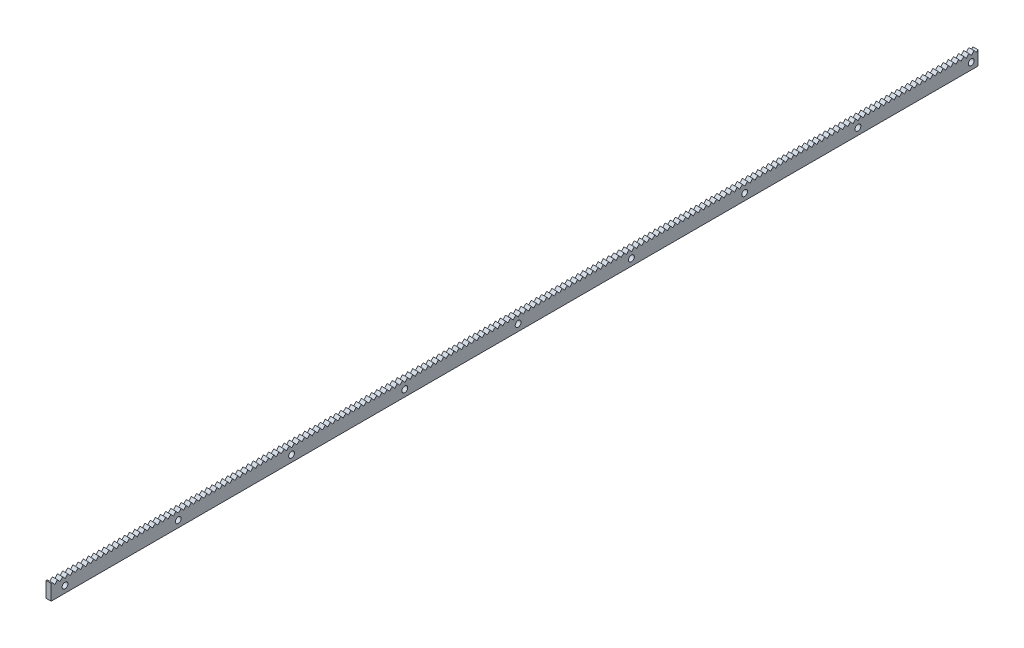
from build123d import *

# Parameters (mm, degrees)
SKETCH1_W           = 5
SKETCH1_H           = 15
BOSS_EXTRUDE1_DEPTH = 900
SKETCH2_R           = 2.838222715
CUT_EXTRUDE1_DEPTH  = 900
LPATTERN1_COUNT     = 10
LPATTERN1_PITCH     = 110
CUT_EXTRUDE2_DEPTH  = 900
LPATTERN2_COUNT     = 200
LPATTERN2_PITCH     = 5


with BuildPart() as part:
    # Sketch1 → Boss-Extrude1 (new body)
    with BuildSketch(Plane.XY):
        with Locations((-15.748175182, 0.98540146)):
            Rectangle(SKETCH1_W, SKETCH1_H)
    extrude(amount=BOSS_EXTRUDE1_DEPTH)

    # Sketch2 → Cut-Extrude1 (cut)
    with BuildSketch(Plane(origin=(-13.248175182, 0, 0), x_dir=(0, 0, -1), z_dir=(1, 0, 0))):
        with Locations((-886.561523168, 0)):
            Circle(SKETCH2_R)
    cut_extrude1 = extrude(amount=-CUT_EXTRUDE1_DEPTH, mode=Mode.SUBTRACT)

    # LPattern1: Cut-Extrude1 ×10
    with Locations(*[(0, 0, -i * LPATTERN1_PITCH) for i in range(1, LPATTERN1_COUNT)]):
        add(cut_extrude1, mode=Mode.SUBTRACT)

    # Sketch3 → Cut-Extrude2 (cut)
    with BuildSketch(Plane(origin=(-13.248175182, 0, 0), x_dir=(0, 0, -1), z_dir=(1, 0, 0))):
        Polygon((-898.861297037, 8.48540146), (-896.361297037, 5.726538249), (-893.861297037, 8.48540146), align=None)
    cut_extrude2 = extrude(amount=-CUT_EXTRUDE2_DEPTH, mode=Mode.SUBTRACT)

    # LPattern2: Cut-Extrude2 ×200
    with Locations(*[(0, 0, -i * LPATTERN2_PITCH) for i in range(1, LPATTERN2_COUNT)]):
        add(cut_extrude2, mode=Mode.SUBTRACT)


solid = part.part
